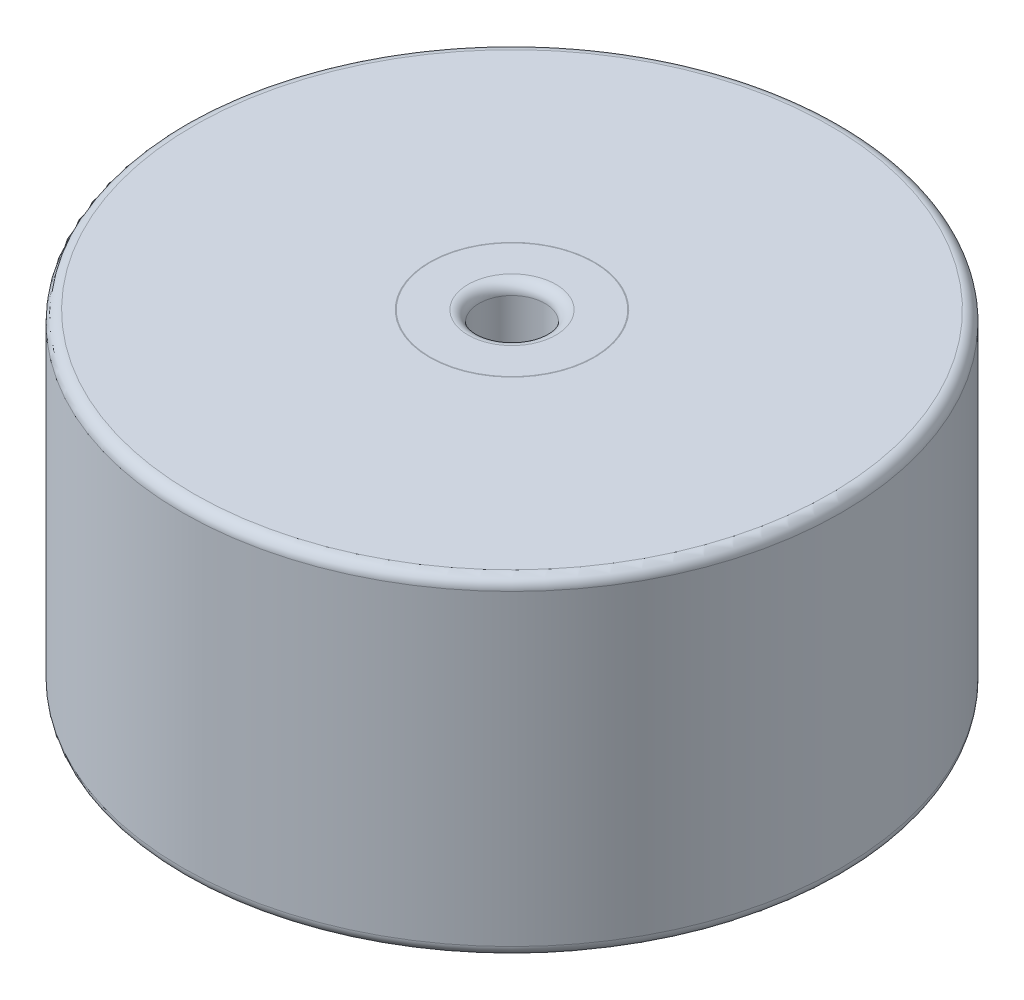
from build123d import *

# Parameters (mm, degrees)
SKETCH1_R                = 300.00000000000006
SKETCH1_R_2              = 75.00000000000001
BOSS_EXTRUDE2_DEPTH      = 300
BOSS_EXTRUDE3_DEPTH      = 0.01
BOSS_EXTRUDE3_DEPTH_BACK = 300
SKETCH2_R                = 75.00000000000003
CUT_EXTRUDE1_DEPTH       = 520.6210158375045
CUT_EXTRUDE1_DEPTH_BACK  = 520.6210158375045
SKETCH3_R                = 30
FILLET1_R                = 10
FILLET2_R                = 10
FILLET3_R                = 10


with BuildPart() as part:
    # Sketch1 → Boss-Extrude2 (new body)
    with BuildSketch(Plane(origin=(0, 0, 0), x_dir=(1, 0, 0), z_dir=(0, 1, 0))):
        with Locations(Location((0, 0, 0), (0, 0, 270))):
            Circle(SKETCH1_R)
        with Locations(Location((0, 0, 0), (0, 0, 270))):
            Circle(SKETCH1_R_2, mode=Mode.SUBTRACT)
    extrude(amount=BOSS_EXTRUDE2_DEPTH)

    # Sketch2 → Boss-Extrude3 (add, two sides: drawn at the far end of the back side and taken through both)
    with BuildSketch(Plane(origin=(0, 300, 0), x_dir=(1, 0, 0), z_dir=(0, 1, 0)).offset(-BOSS_EXTRUDE3_DEPTH_BACK)):
        with Locations(Location((0, 0, 0), (0, 0, 270))):
            Circle(SKETCH2_R)
    extrude(amount=BOSS_EXTRUDE3_DEPTH + BOSS_EXTRUDE3_DEPTH_BACK)

    # Sketch3 → Cut-Extrude1 (cut, two sides: drawn at the far end of the back side and taken through both)
    with BuildSketch(Plane(origin=(0, 300.01, 0), x_dir=(1, 0, 0), z_dir=(0, 1, 0)).offset(-CUT_EXTRUDE1_DEPTH_BACK)):
        with Locations(Location((0, 0, 0), (0, 0, 270))):
            Circle(SKETCH3_R)
    extrude(amount=CUT_EXTRUDE1_DEPTH + CUT_EXTRUDE1_DEPTH_BACK, mode=Mode.SUBTRACT)

    # Fillet1
    # the kernel refuses this fillet: 10 mm, written as the material it takes off along each edge
    with BuildSketch(Plane(origin=(0, 300.01, 0), x_dir=(-1.8e-16, 0, 1), z_dir=(-1, 0, -1.8e-16))) as fillet1_piece_1:
        with BuildLine():
            CenterArc((74.55289822187787, -10), FILLET1_R, 87.43744126687696, 2.5625587331230406)
            Line((74.55289822187787, 0), (75.00000000000003, 0))
            Line((75.00000000000003, 0), (75.00000000000001, -0.00999999999999091))
        make_face()
    revolve(axis=Axis((0, 300.01, 0), (0, 1, 0)), mode=Mode.SUBTRACT)
    with BuildSketch(Plane(origin=(0, 300.01, 0), x_dir=(-1.8e-16, 0, 1), z_dir=(-1, 0, -1.8e-16))) as fillet1_piece_2:
        with BuildLine():
            CenterArc((30 + FILLET1_R, -FILLET1_R), FILLET1_R, 90, 90)
            Line((30 + FILLET1_R, 0), (30, 0))
            Line((30, 0), (30, -FILLET1_R))
        make_face()
    revolve(axis=Axis((0, 300.01, 0), (0, 1, 0)), mode=Mode.SUBTRACT)
    with BuildSketch(Plane(origin=(0, 0, 0), x_dir=(-1.8e-16, 0, 1), z_dir=(-1, 0, -1.8e-16))) as fillet1_piece_3:
        with BuildLine():
            CenterArc((300.00000000000006 - FILLET1_R, FILLET1_R), FILLET1_R, 270, 90)
            Line((300.00000000000006 - FILLET1_R, -1.78e-15), (300.00000000000006, 0))
            Line((300.00000000000006, 0), (300.00000000000006, FILLET1_R))
        make_face()
    revolve(axis=Axis((0, 0, 0), (0, 1, 0)), mode=Mode.SUBTRACT)
    with BuildSketch(Plane(origin=(0, 300, 0), x_dir=(-1.8e-16, 0, 1), z_dir=(-1, 0, -1.8e-16))) as fillet1_piece_4:
        with BuildLine():
            CenterArc((300.00000000000006 - FILLET1_R, -FILLET1_R), FILLET1_R, 0, 90)
            Line((300.00000000000006 - FILLET1_R, 0), (300.00000000000006, 0))
            Line((300.00000000000006, 0), (300.00000000000006, -FILLET1_R))
        make_face()
    revolve(axis=Axis((0, 300, 0), (0, 1, 0)), mode=Mode.SUBTRACT)

    # Fillet2
    # the kernel refuses this fillet: 10 mm, written as the material it adds along each edge
    with BuildSketch(Plane(origin=(0, 300, 0), x_dir=(-1.8e-16, 0, 1), z_dir=(-1, 0, -1.8e-16))) as fillet2_piece_1:
        with BuildLine():
            CenterArc((75.18527469203002, 10), FILLET2_R, 268.1880728619216, 1.8119271380783744)
            ThreePointArc((74.86908645695401, 0.00499999999999545), (74.93455141662679, 0.00271438793976131), (75.00000000000001, 0))
            Line((75.00000000000001, 0), (75.18527469203002, 0))
        make_face()
    revolve(axis=Axis((0, 300, 0), (0, 1, 0)))

    # Fillet3
    fillet3_edges = [part.edges().sort_by_distance(p)[0] for p in [
        (2.251e-14, 0, -30),
    ]]
    fillet(fillet3_edges, radius=FILLET3_R)


solid = part.part
